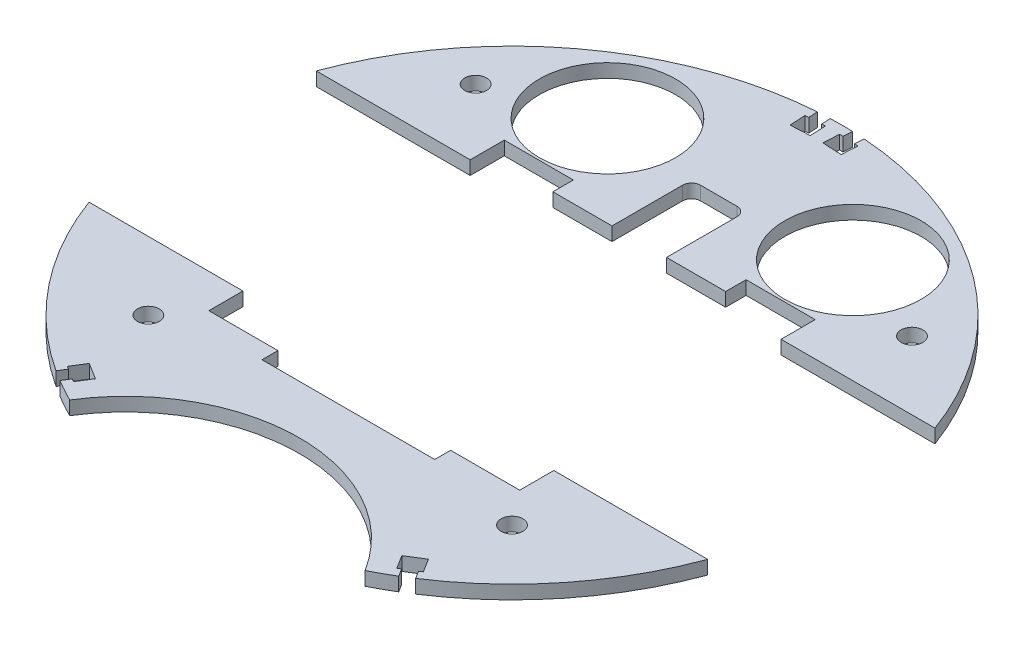
from build123d import *

# Parameters (mm, degrees)
BOSS_EXTRUDE1_DEPTH  = 3
SOLENOID_PLACEMENT_W = 38
SOLENOID_PLACEMENT_H = 64
CUT_EXTRUDE1_DEPTH   = 103.574363269
SKETCH7_R            = 15
CUT_EXTRUDE6_DEPTH   = 103.574363269
SKETCH8_R            = 2.4
CUT_EXTRUDE7_DEPTH   = 103.574363269
CUT_EXTRUDE3_DEPTH   = 103.574363269
CUT_EXTRUDE8_DEPTH   = 100.481153994
CUT_EXTRUDE9_DEPTH   = 100.481153994


with BuildPart() as part:
    # Sketch1 → Boss-Extrude1 (new body)
    with BuildSketch(Plane(origin=(0, 0, 0), x_dir=(1, 0, 0), z_dir=(0, 1, 0))):
        with BuildLine():
            ThreePointArc((32.48910875, -64.812867647), (0, 72.5), (-32.48910875, -64.812867647))
            ThreePointArc((-32.48910875, -64.812867647), (0, -46.75), (32.48910875, -64.812867647))
        make_face()
    extrude(amount=BOSS_EXTRUDE1_DEPTH)

    # solenoid placement → Cut-Extrude1 (cut, through all)
    with BuildSketch(Plane(origin=(0, 3, 0), x_dir=(1, 0, 0), z_dir=(0, 1, 0))):
        with Locations((0, -4)):
            Rectangle(SOLENOID_PLACEMENT_W, SOLENOID_PLACEMENT_H)
    extrude(amount=-CUT_EXTRUDE1_DEPTH, mode=Mode.SUBTRACT)

    # Sketch7 → Cut-Extrude6 (cut, through all)
    with BuildSketch(Plane(origin=(0, 3, 0), x_dir=(1, 0, 0), z_dir=(0, 1, 0))):
        with Locations((27, 48)):
            Circle(SKETCH7_R)
        with Locations((-27, 48)):
            Circle(SKETCH7_R)
    extrude(amount=-CUT_EXTRUDE6_DEPTH, mode=Mode.SUBTRACT)

    # Sketch8 → Cut-Extrude7 (cut, through all)
    with BuildSketch(Plane(origin=(0, 3, 0), x_dir=(1, 0, 0), z_dir=(0, 1, 0))):
        with Locations((40, -40)):
            Circle(SKETCH8_R)
        with Locations((-40, -40)):
            Circle(SKETCH8_R)
        with Locations((48, 40)):
            Circle(SKETCH8_R)
        with Locations((-48, 40)):
            Circle(SKETCH8_R)
    extrude(amount=-CUT_EXTRUDE7_DEPTH, mode=Mode.SUBTRACT)

    # Sketch3 → Cut-Extrude3 (cut, through all)
    with BuildSketch(Plane(origin=(0, 3, 0), x_dir=(1, 0, 0), z_dir=(0, 1, 0))):
        with BuildLine():
            Line((-34.2, -32.5), (-22.2, -32.5))
            Line((-22.2, -32.5), (-19, -32.5))
            Line((-19, -32.5), (-19, 32.5))
            Line((-19, 32.5), (-22.2, 32.5))
            Line((-22.2, 32.5), (-34.2, 32.5))
            Line((-34.2, 32.5), (-34.2, 25))
            Line((-34.2, 25), (-68.053287944, 25))
            ThreePointArc((-68.053287944, 25), (-72.5, 0), (-68.053287944, -25))
            Line((-68.053287944, -25), (-34.2, -25))
            Line((-34.2, -25), (-34.2, -32.5))
        make_face()
        with BuildLine():
            Line((19, 32.5), (19, -32.5))
            Line((19, -32.5), (22.2, -32.5))
            Line((22.2, -32.5), (34.2, -32.5))
            Line((34.2, -32.5), (34.2, -25))
            Line((34.2, -25), (68.053287944, -25))
            ThreePointArc((68.053287944, -25), (72.5, 0), (68.053287944, 25))
            Line((68.053287944, 25), (34.2, 25))
            Line((34.2, 25), (34.2, 32.5))
            Line((34.2, 32.5), (22.2, 32.5))
            Line((22.2, 32.5), (19, 32.5))
        make_face()
    extrude(amount=-CUT_EXTRUDE3_DEPTH, mode=Mode.SUBTRACT)


with BuildPart() as cut_extrude3_piece_1:
    # of the separate pieces the step leaves, piece 1, a body of its own (cut_extrude3_pieces)
    add(part.part.solids().sort_by_distance((68.053287944, 0, -25))[0])

    # Sketch9 → Cut-Extrude8 (cut, through all)
    with BuildSketch(Plane(origin=(0, 3, 0), x_dir=(1, 0, 0), z_dir=(0, 1, 0))):
        with BuildLine():
            Line((6, 43.5), (6, 28))
            Line((6, 28), (-6, 28))
            Line((-6, 28), (-6, 43.5))
            ThreePointArc((-6, 43.5), (-5.414213562, 44.914213562), (-4, 45.5))
            Line((-4, 45.5), (4, 45.5))
            ThreePointArc((4, 45.5), (5.414213562, 44.914213562), (6, 43.5))
        make_face()
    extrude(amount=-CUT_EXTRUDE8_DEPTH, mode=Mode.SUBTRACT)


with BuildPart() as cut_extrude3_piece_2:
    # of the separate pieces the step leaves, piece 2, a body of its own (cut_extrude3_pieces)
    add(part.part.solids().sort_by_distance((32.48910875, 0, 64.812867647))[0])


with BuildPart() as cut_extrude9_tool:
    # Sketch10 → Cut-Extrude9 (new, through all)
    with BuildSketch(Plane(origin=(0, 3, 0), x_dir=(1, 0, 0), z_dir=(0, 1, 0))):
        Polygon((1.384421307, 67.019392736), (5.62859683, 66.796964922), (5.811772676, 70.292168293), (5.037834787, 70.332728659), (5.1425067, 72.329987729), (2.446206956, 72.471294811), (2.341535043, 70.474035741), (1.567597154, 70.514596107), align=None)
        Polygon((-5.037834787, 70.332728659), (-5.811772676, 70.292168293), (-5.62859683, 66.796964922), (-1.384421307, 67.019392736), (-1.567597154, 70.514596107), (-2.341535043, 70.474035741), (-2.446206956, 72.471294811), (-5.1425067, 72.329987729), align=None)
        Polygon((37.306692908, -55.693144006), (33.702488499, -57.945300879), (35.557205924, -60.913469216), (36.214443199, -60.502781786), (37.274281727, -62.198877978), (39.564011587, -60.768095965), (38.504173058, -59.071999772), (39.161410333, -58.661312343), align=None)
        Polygon((-33.702488499, -57.945300879), (-37.306692908, -55.693144006), (-39.161410333, -58.661312343), (-38.504173058, -59.071999772), (-39.564011587, -60.768095965), (-37.274281727, -62.198877978), (-36.214443199, -60.502781786), (-35.557205924, -60.913469216), align=None)
    extrude(amount=-CUT_EXTRUDE9_DEPTH)


with BuildPart() as cut_extrude3_piece_1_1:
    add(cut_extrude3_piece_1.part)

    # Cut-Extrude9: cut by cut_extrude9_tool
    add(cut_extrude9_tool.part, mode=Mode.SUBTRACT)


with BuildPart() as cut_extrude3_piece_2_1:
    add(cut_extrude3_piece_2.part)

    # Cut-Extrude9: cut by cut_extrude9_tool
    add(cut_extrude9_tool.part, mode=Mode.SUBTRACT)


solid = Compound([cut_extrude3_piece_1_1.part, cut_extrude3_piece_2_1.part])
